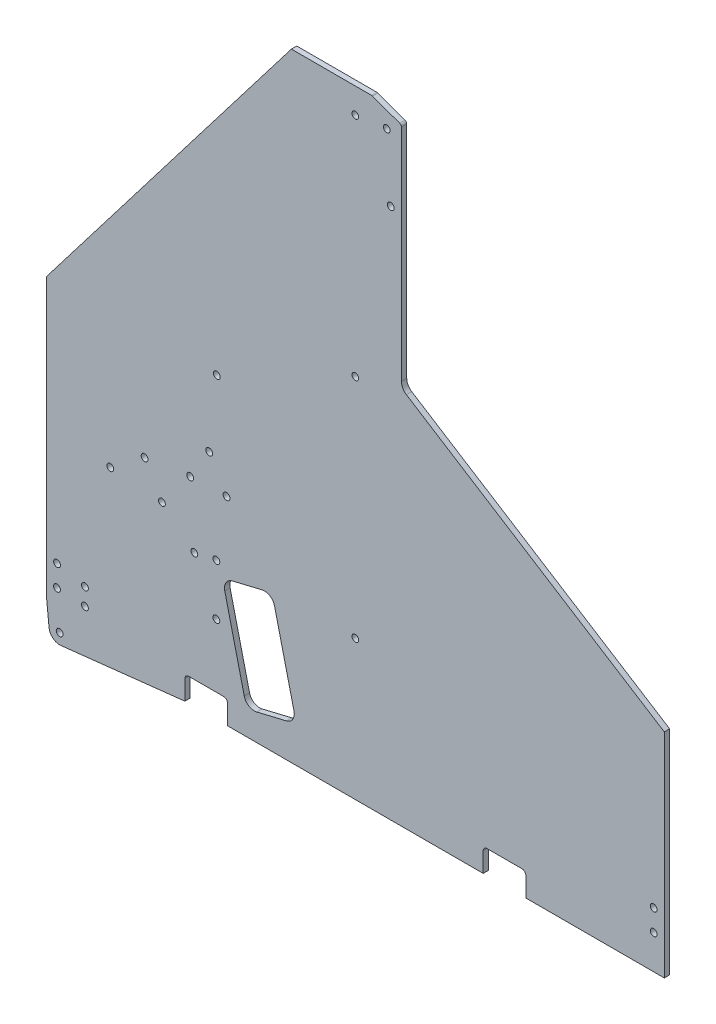
from build123d import *

# Parameters (mm, degrees)
SKETCH1_R           = 2.032
SKETCH1_R_2         = 2
BOSS_EXTRUDE1_DEPTH = 3.175
FILLET1_R           = 2.286
FILLET2_R           = 6.35
SKETCH2_R           = 2.032
CUT_EXTRUDE1_DEPTH  = 507.700158896
FILLET3_R           = 1.5875
CUT_EXTRUDE2_DEPTH  = 507.700158896


with BuildPart() as part:
    # Sketch1 → Boss-Extrude1 (new body)
    with BuildSketch(Plane.XY):
        with BuildLine():
            Line((8.639060666, -28.536126099), (82.55, -20.32))
            Line((82.55, -20.32), (82.55, -6.35))
            Line((82.55, -6.35), (107.95, -6.35))
            Line((107.95, -6.35), (107.95, -20.32))
            Line((107.95, -20.32), (260.35, -20.32))
            Line((260.35, -20.32), (260.35, -6.35))
            Line((260.35, -6.35), (285.75, -6.35))
            Line((285.75, -6.35), (285.75, -20.32))
            Line((285.75, -20.32), (368.3, -20.32))
            Line((368.3, -20.32), (368.3, 106.68))
            Line((368.3, 106.68), (211.61375, 205.74))
            Line((211.61375, 205.74), (211.61375, 341.63))
            Line((211.61375, 341.63), (194.14998, 347.98))
            Line((194.14998, 347.98), (184.15, 347.98))
            Line((184.15, 347.98), (146.05, 347.98))
            Line((146.05, 347.98), (0, 157.48))
            Line((0, 157.48), (0, 0))
            Line((0, 0), (0, -6.35))
            ThreePointArc((0, -6.35), (0.007883354, -6.666317007), (0.031513842, -6.981848616))
            Line((0.031513842, -6.981848616), (1.619013842, -22.856848616))
            ThreePointArc((1.619013842, -22.856848616), (3.943628298, -27.161748811), (8.639060666, -28.536126099))
        make_face()
        with Locations((7.9375, -22.225)):
            Circle(SKETCH1_R, mode=Mode.SUBTRACT)
        with Locations((6.35, 0)):
            Circle(SKETCH1_R, mode=Mode.SUBTRACT)
        with Locations((6.35, 12.7)):
            Circle(SKETCH1_R, mode=Mode.SUBTRACT)
        with Locations((88.216909404, 59.136578314)):
            Circle(SKETCH1_R, mode=Mode.SUBTRACT)
        with Locations((184.15, 62.98)):
            Circle(SKETCH1_R_2, mode=Mode.SUBTRACT)
        with Locations((38.1, 78.105)):
            Circle(SKETCH1_R, mode=Mode.SUBTRACT)
        with Locations((68.887329744, 75.518700365)):
            Circle(SKETCH1_R, mode=Mode.SUBTRACT)
        with Locations((58.568579744, 93.391299635)):
            Circle(SKETCH1_R, mode=Mode.SUBTRACT)
        with Locations((85.725, 97.155)):
            Circle(SKETCH1_R, mode=Mode.SUBTRACT)
        with Locations((107.382158942, 97.743700365)):
            Circle(SKETCH1_R, mode=Mode.SUBTRACT)
        with Locations((97.063408942, 115.616299635)):
            Circle(SKETCH1_R, mode=Mode.SUBTRACT)
        with Locations((101.6, 157.48)):
            Circle(SKETCH1_R, mode=Mode.SUBTRACT)
        with Locations((361.95, 0)):
            Circle(SKETCH1_R, mode=Mode.SUBTRACT)
        with Locations((361.95, 12.7)):
            Circle(SKETCH1_R, mode=Mode.SUBTRACT)
        with Locations((184.15, 197.98)):
            Circle(SKETCH1_R_2, mode=Mode.SUBTRACT)
        with Locations((184.15, 332.98)):
            Circle(SKETCH1_R_2, mode=Mode.SUBTRACT)
        with Locations((205.26375, 296.418)):
            Circle(SKETCH1_R, mode=Mode.SUBTRACT)
        with Locations((202.881865, 335.28)):
            Circle(SKETCH1_R_2, mode=Mode.SUBTRACT)
    extrude(amount=BOSS_EXTRUDE1_DEPTH)

    # Fillet1
    fillet1_edges = [part.edges().sort_by_distance(p)[0] for p in [
        (285.75, -6.35, 1.5875),
        (107.95, -6.35, 1.5875),
        (260.35, -6.35, 1.5875),
        (82.55, -6.35, 1.5875),
    ]]
    fillet(fillet1_edges, radius=FILLET1_R)

    # Fillet2
    fillet2_edges = [part.edges().sort_by_distance(p)[0] for p in [
        (211.61375, 205.74, 1.5875),
    ]]
    fillet(fillet2_edges, radius=FILLET2_R)

    # Sketch2 → Cut-Extrude1 (cut, through all)
    with BuildSketch(Plane(origin=(0, 0, 0), x_dir=(-1, 0, 0), z_dir=(0, 0, -1))):
        with Locations((-101.339768613, 61.847479268)):
            Circle(SKETCH2_R)
        with Locations((-101.339768613, 31.367479268)):
            Circle(SKETCH2_R)
        with Locations((-23.011998341, 8.96398506)):
            Circle(SKETCH2_R)
        with Locations((-23.011998341, -1.19601494)):
            Circle(SKETCH2_R)
    extrude(amount=-CUT_EXTRUDE1_DEPTH, mode=Mode.SUBTRACT)

    # Fillet3
    fillet3_edges = [part.edges().sort_by_distance(p)[0] for p in [
        (211.61375, 341.63, 1.5875),
        (194.14998, 347.98, 1.5875),
    ]]
    fillet(fillet3_edges, radius=FILLET3_R)

    # Sketch3 → Cut-Extrude2 (cut, through all)
    with BuildSketch(Plane.XY.offset(3.175)):
        with BuildLine():
            Line((128.576348553, 60.121218076), (110.877748682, 55.878628939))
            ThreePointArc((110.877748682, 55.878628939), (107.074938198, 53.117732923), (106.338193412, 48.476491548))
            Line((106.338193412, 48.476491548), (117.947036217, 0.048454537))
            ThreePointArc((117.947036217, 0.048454537), (120.707932232, -3.754355947), (125.349173608, -4.491100733))
            Line((125.349173608, -4.491100733), (143.047773479, -0.248511595))
            ThreePointArc((143.047773479, -0.248511595), (146.850583963, 2.51238442), (147.587328749, 7.153625796))
            Line((147.587328749, 7.153625796), (135.978485944, 55.581662807))
            ThreePointArc((135.978485944, 55.581662807), (133.217589928, 59.38447329), (128.576348553, 60.121218076))
        make_face()
    extrude(amount=-CUT_EXTRUDE2_DEPTH, mode=Mode.SUBTRACT)


solid = part.part
